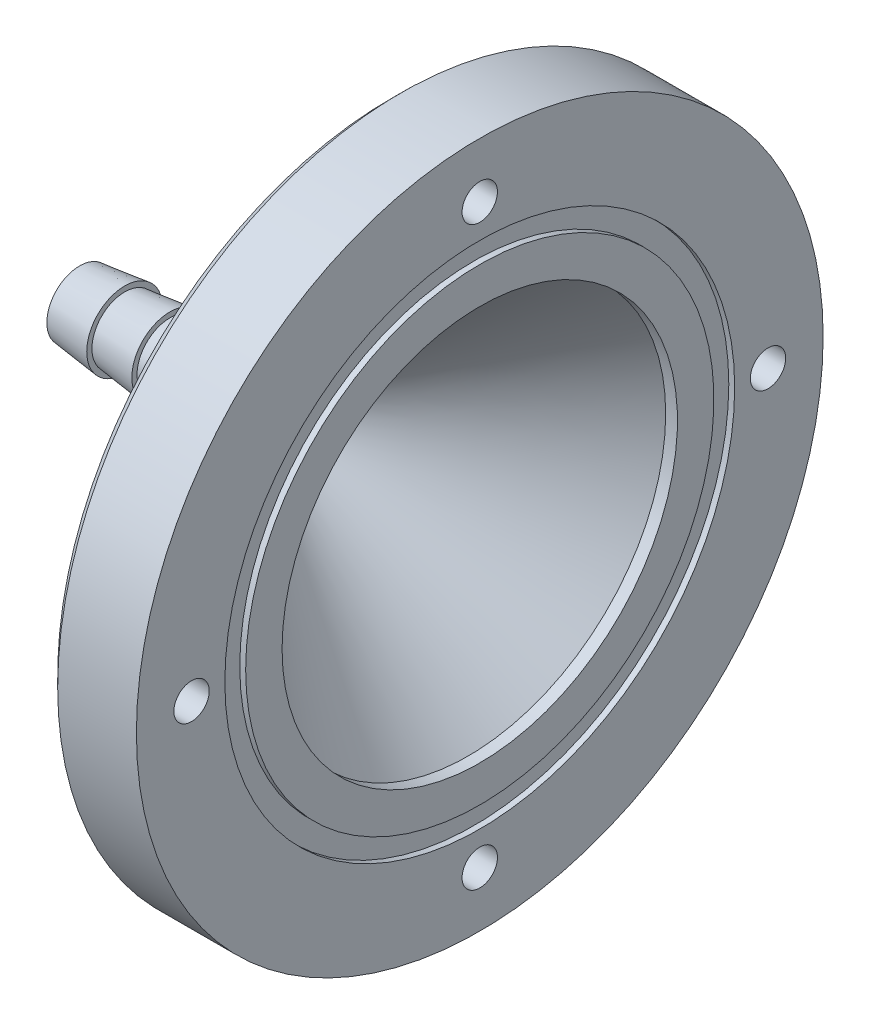
from build123d import *

# Parameters (mm, degrees)
CBORE_FOR_M3_HEX_SOCKET_HEAD_CAP_SCREW2_D           = 3.4
CBORE_FOR_M3_HEX_SOCKET_HEAD_CAP_SCREW2_DEPTH       = 8.566
CBORE_FOR_M3_HEX_SOCKET_HEAD_CAP_SCREW2_CBORE_D     = 6.5
CBORE_FOR_M3_HEX_SOCKET_HEAD_CAP_SCREW2_CBORE_DEPTH = 3.4
CBORE_FOR_M3_HEX_SOCKET_HEAD_CAP_SCREW2_TIP         = 1.021463052
CHAMFER1_SIZE                                       = 1


with BuildPart() as part:
    # Sketch1 → Revolve17 (revolve)
    with BuildSketch(Plane.XY):
        Polygon((-14.175209939, 3.15), (-14.175209939, 3.65), (-18.508543272, 3.15), (-18.508543272, 1.9), (0, 1.9), (18.814462881, 19), (19.946462881, 19), (19.946462881, 22.5), (19.380462881, 22.5), (19.380462881, 24.5), (19.946462881, 24.5), (19.946462881, 33), (11.380462881, 33), (11.380462881, 19), (-5.508543272, 3.65), (-9.841876606, 3.15), (-9.841876606, 3.65), align=None)
    revolve(axis=Axis((-801.920554309, 0, 0), (1, 0, 0)))

    # CBORE for M3 Hex Socket Head Cap Screw2
    with Locations(Plane.ZY.offset(-11.380462881)):
        with Locations((0, -27.7), (0, 27.7), (27.7, 0), (-27.7, 0)):
            CounterBoreHole(CBORE_FOR_M3_HEX_SOCKET_HEAD_CAP_SCREW2_D / 2, CBORE_FOR_M3_HEX_SOCKET_HEAD_CAP_SCREW2_CBORE_D / 2, CBORE_FOR_M3_HEX_SOCKET_HEAD_CAP_SCREW2_CBORE_DEPTH, depth=CBORE_FOR_M3_HEX_SOCKET_HEAD_CAP_SCREW2_DEPTH)
            with Locations((0, 0, -(CBORE_FOR_M3_HEX_SOCKET_HEAD_CAP_SCREW2_DEPTH + CBORE_FOR_M3_HEX_SOCKET_HEAD_CAP_SCREW2_TIP / 2))):  # 118° drill point
                Cone(0, CBORE_FOR_M3_HEX_SOCKET_HEAD_CAP_SCREW2_D / 2, CBORE_FOR_M3_HEX_SOCKET_HEAD_CAP_SCREW2_TIP, mode=Mode.SUBTRACT)

    # Chamfer1
    chamfer1_edges = [part.edges().sort_by_distance(p)[0] for p in [
        (11.380462881, -33, 0),
    ]]
    chamfer(chamfer1_edges, length=CHAMFER1_SIZE)


solid = part.part
